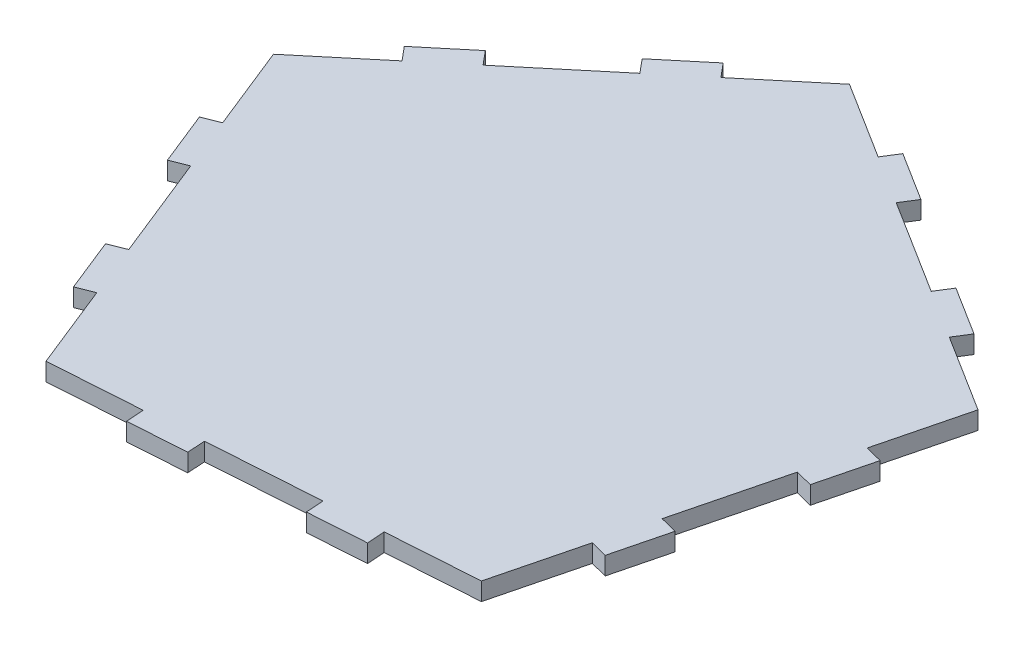
from build123d import *

# Parameters (mm, degrees)
BOSS_EXTRUDE1_DEPTH = 3.18
CUT_EXTRUDE2_DEPTH  = 10
CIRPATTERN2_COUNT   = 5


with BuildPart() as part:
    # Sketch1 → Boss-Extrude1 (new body)
    with BuildSketch(Plane(origin=(0, 0, 0), x_dir=(1, 0, 0), z_dir=(0, 1, 0))):
        Polygon((-63.737105075, 16.079573621), (-34.988431912, -55.6487276), (42.113064941, -50.472378708), (61.015737415, 24.455082065), (-4.403265369, 65.586450623), align=None)
    extrude(amount=BOSS_EXTRUDE1_DEPTH)

    # Sketch3 → Cut-Extrude2 (cut)
    with BuildSketch(Plane(origin=(0, 3.18, 0), x_dir=(1, 0, 0), z_dir=(0, 1, 0))):
        Polygon((-47.473883695, 25.50769427), (-49.511175703, 27.949382471), (-63.737105075, 16.079573621), (-62.493165655, 12.975929119), align=None)
        Polygon((-26.476381351, 47.169118399), (-41.663989094, 34.496905844), (-39.626697085, 32.055217643), (-24.439089342, 44.727430198), align=None)
        Polygon((-4.403265369, 65.586450623), (-18.629194741, 53.716641772), (-16.591902733, 51.274953571), (-1.572620772, 63.806718722), align=None)
    cut_extrude2 = extrude(amount=-CUT_EXTRUDE2_DEPTH, mode=Mode.SUBTRACT)

    # CirPattern2: Cut-Extrude2 ×5 about axis
    cirpattern2_axis = Axis((0, 3.339, 0), (0, -1, 0))
    for i in range(1, CIRPATTERN2_COUNT):
        add(cut_extrude2.rotate(cirpattern2_axis, i * 360 / CIRPATTERN2_COUNT), mode=Mode.SUBTRACT)


solid = part.part
